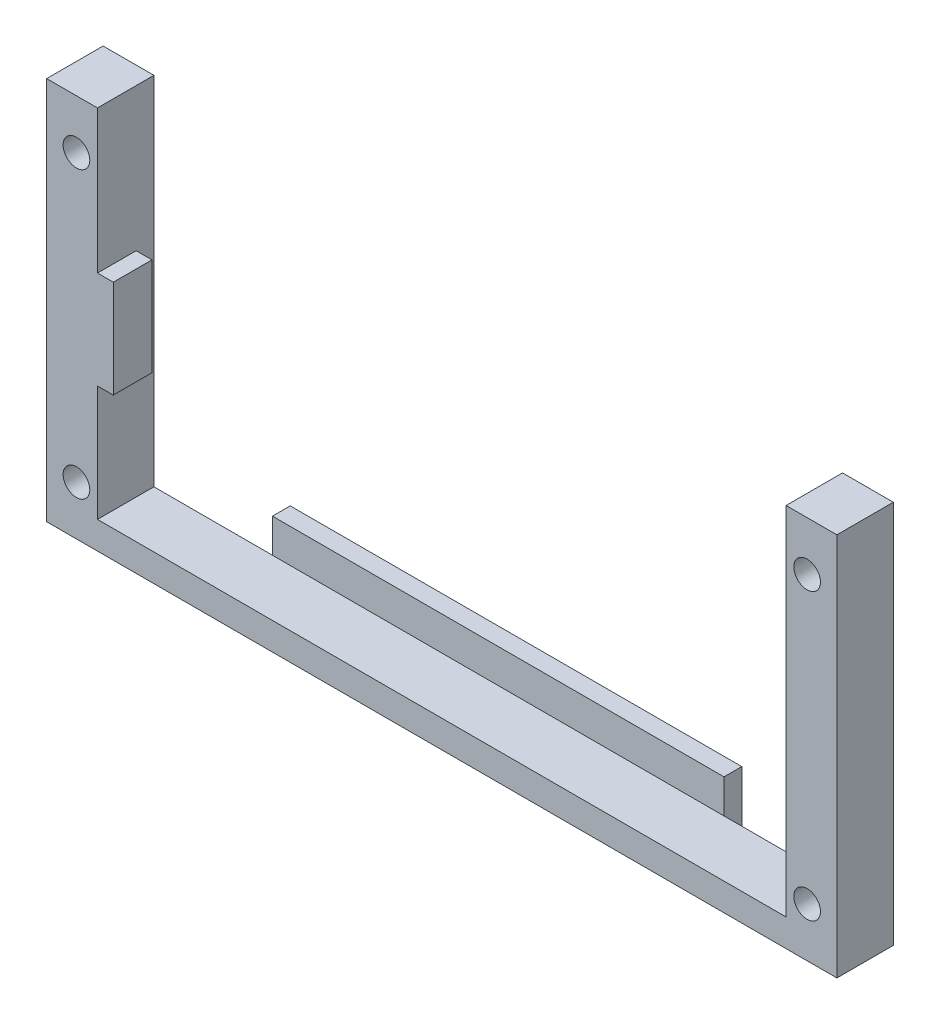
from build123d import *

# Parameters (mm, degrees)
SKETCH1_W           = 88.9
SKETCH1_H           = 43.18
SKETCH1_W_2         = 77.47
SKETCH1_H_2         = 37
BOSS_EXTRUDE1_DEPTH = 6.35
SKETCH2_R           = 1.5
CUT_EXTRUDE1_DEPTH  = 10.16
SKETCH4_W           = 4.35
SKETCH4_H           = 11
BOSS_EXTRUDE3_DEPTH = 1.778
SKETCH5_W           = 77.47
SKETCH5_H           = 3.09
CUT_EXTRUDE2_DEPTH  = 50.822214925
SKETCH6_W           = 50.8
SKETCH6_H           = 3.09
BOSS_EXTRUDE4_DEPTH = 2
SKETCH7_W           = 50.8
SKETCH7_H           = 2
BOSS_EXTRUDE5_DEPTH = 3.81


with BuildPart() as part:
    # Sketch1 → Boss-Extrude1 (new body)
    with BuildSketch(Plane.XY):
        Rectangle(SKETCH1_W, SKETCH1_H)
        Rectangle(SKETCH1_W_2, SKETCH1_H_2, mode=Mode.SUBTRACT)
    extrude(amount=BOSS_EXTRUDE1_DEPTH)

    # Sketch2 → Cut-Extrude1 (cut)
    with BuildSketch(Plane.XY.offset(6.35)):
        with Locations((41.09999984, 16.049999905)):
            Circle(SKETCH2_R)
        with Locations((-41.09999984, 16.049999905)):
            Circle(SKETCH2_R)
        with Locations((-41.09999984, -16.049999905)):
            Circle(SKETCH2_R)
        with Locations((41.09999984, -16.049999905)):
            Circle(SKETCH2_R)
    extrude(amount=-CUT_EXTRUDE1_DEPTH, mode=Mode.SUBTRACT)

    # Sketch4 → Boss-Extrude3 (add)
    with BuildSketch(Plane(origin=(-38.735, 0, 0), x_dir=(0, 0, -1), z_dir=(1, 0, 0))):
        with Locations((-4.175, 0)):
            Rectangle(SKETCH4_W, SKETCH4_H)
    extrude(amount=BOSS_EXTRUDE3_DEPTH)

    # Sketch5 → Cut-Extrude2 (cut, through all)
    with BuildSketch(Plane(origin=(0, 0, 0), x_dir=(-1, 0, 0), z_dir=(0, 0, -1))):
        with Locations((0, 20.045)):
            Rectangle(SKETCH5_W, SKETCH5_H)
    extrude(amount=-CUT_EXTRUDE2_DEPTH, mode=Mode.SUBTRACT)

    # Sketch6 → Boss-Extrude4 (add)
    with BuildSketch(Plane(origin=(0, 0, 0), x_dir=(-1, 0, 0), z_dir=(0, 0, -1))):
        with Locations((0, -20.045)):
            Rectangle(SKETCH6_W, SKETCH6_H)
    extrude(amount=BOSS_EXTRUDE4_DEPTH)

    # Sketch7 → Boss-Extrude5 (add)
    with BuildSketch(Plane(origin=(0, -18.5, 0), x_dir=(1, 0, 0), z_dir=(0, 1, 0))):
        with Locations((0, 1)):
            Rectangle(SKETCH7_W, SKETCH7_H)
    extrude(amount=BOSS_EXTRUDE5_DEPTH)


solid = part.part
